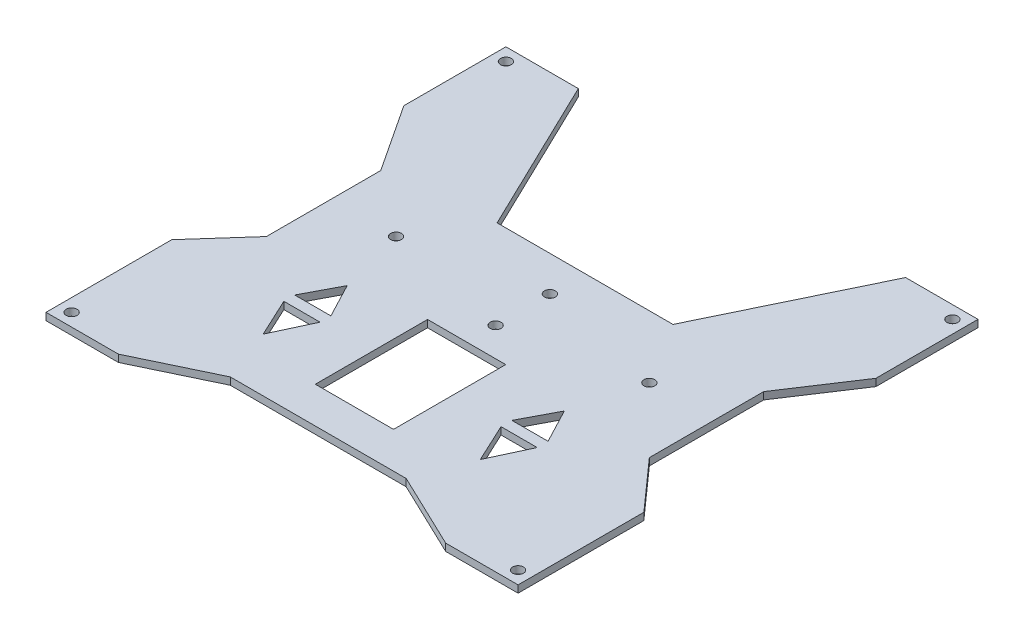
from build123d import *

# Parameters (mm, degrees)
SKETCH1_W           = 130.431067812
SKETCH1_H           = 127.071067812
SKETCH1_R           = 1.5
BOSS_EXTRUDE1_DEPTH = 2
CUT_EXTRUDE2_DEPTH  = 2
CUT_EXTRUDE3_DEPTH  = 2
SKETCH5_W           = 21.6
SKETCH5_H           = 31
CUT_EXTRUDE4_DEPTH  = 10
SKETCH6_R           = 1.5
CUT_EXTRUDE5_DEPTH  = 10
CUT_EXTRUDE6_DEPTH  = 10
CUT_EXTRUDE7_DEPTH  = 10


with BuildPart() as part:
    # Sketch1 → Boss-Extrude1 (new body)
    with BuildSketch(Plane(origin=(0, 0, 0), x_dir=(1, 0, 0), z_dir=(0, 1, 0))):
        with Locations((61.68, -60)):
            Rectangle(SKETCH1_W, SKETCH1_H)
        with Locations((0, -120)):
            Circle(SKETCH1_R, mode=Mode.SUBTRACT)
        with Locations((123.36, -120)):
            Circle(SKETCH1_R, mode=Mode.SUBTRACT)
        Circle(SKETCH1_R, mode=Mode.SUBTRACT)
        with Locations((123.36, 0)):
            Circle(SKETCH1_R, mode=Mode.SUBTRACT)
    extrude(amount=BOSS_EXTRUDE1_DEPTH)

    # Sketch3 → Cut-Extrude2 (cut)
    with BuildSketch(Plane(origin=(0, 2, 0), x_dir=(1, 0, 0), z_dir=(0, 1, 0))):
        Polygon((16.464466094, 3.535533906), (106.895533906, 3.535533906), (85.98014536, -39.812186932), (37.37985464, -39.812186932), align=None)
    extrude(amount=-CUT_EXTRUDE2_DEPTH, mode=Mode.SUBTRACT)

    # Sketch4 → Cut-Extrude3 (cut)
    with BuildSketch(Plane(origin=(0, 2, 0), x_dir=(1, 0, 0), z_dir=(0, 1, 0))):
        Polygon((85.98014536, -113.535533906), (37.37985464, -113.535533906), (16.464466094, -123.535533906), (106.895533906, -123.535533906), align=None)
    extrude(amount=-CUT_EXTRUDE3_DEPTH, mode=Mode.SUBTRACT)

    # Sketch5 → Cut-Extrude4 (cut)
    with BuildSketch(Plane(origin=(0, 2, 0), x_dir=(1, 0, 0), z_dir=(0, 1, 0))):
        with Locations((61.68, -88.035533906)):
            Rectangle(SKETCH5_W, SKETCH5_H)
    extrude(amount=-CUT_EXTRUDE4_DEPTH, mode=Mode.SUBTRACT)

    # Sketch6 → Cut-Extrude5 (cut)
    with BuildSketch(Plane(origin=(0, 2, 0), x_dir=(1, 0, 0), z_dir=(0, 1, 0))):
        with Locations((61.68, -64.535533906)):
            Circle(SKETCH6_R)
        with Locations((61.68, -49.535533906)):
            Circle(SKETCH6_R)
        with Locations((26.68, -57.035533906)):
            Circle(SKETCH6_R)
        with Locations((96.68, -57.035533906)):
            Circle(SKETCH6_R)
    extrude(amount=-CUT_EXTRUDE5_DEPTH, mode=Mode.SUBTRACT)

    # Sketch7 → Cut-Extrude6 (cut)
    with BuildSketch(Plane(origin=(0, 2, 0), x_dir=(1, 0, 0), z_dir=(0, 1, 0))):
        Polygon((26.68, -85.035533906), (36.68, -85.035533906), (31.68, -75.537485709), align=None)
        Polygon((36.68, -88.035533906), (26.68, -88.035533906), (31.68, -98.75817479), align=None)
        Polygon((91.68, -75.537485709), (86.68, -85.035533906), (96.68, -85.035533906), align=None)
        Polygon((86.68, -88.035533906), (91.68, -98.75817479), (96.68, -88.035533906), align=None)
    extrude(amount=-CUT_EXTRUDE6_DEPTH, mode=Mode.SUBTRACT)

    # Sketch8 → Cut-Extrude7 (cut)
    with BuildSketch(Plane(origin=(0, 2, 0), x_dir=(1, 0, 0), z_dir=(0, 1, 0))):
        Polygon((8.780452794, -60), (8.780452794, -43.363746638), (-3.535533906, -24.671327131), (-3.535533906, -88.786326042), (8.780452794, -74.953935606), align=None)
        Polygon((114.579547206, -43.363746638), (126.895533906, -24.671327131), (126.895533906, -88.786326042), (114.579547206, -74.953935606), (114.579547206, -60), align=None)
    extrude(amount=-CUT_EXTRUDE7_DEPTH, mode=Mode.SUBTRACT)


solid = part.part
